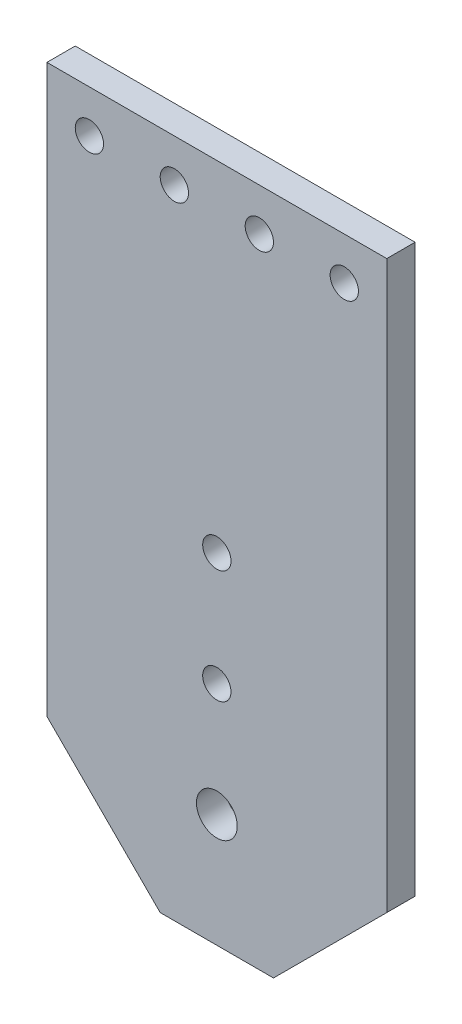
from build123d import *

# Parameters (mm, degrees)
SKETCH1_R           = 1.5875
SKETCH1_R_2         = 2.286
BOSS_EXTRUDE2_DEPTH = 3.175


with BuildPart() as part:
    # Sketch1 → Boss-Extrude2 (new body)
    with BuildSketch(Plane.XY):
        Polygon((-19.05, 4.7625), (-19.05, -58.7375), (-6.35, -71.4375), (6.35, -71.4375), (19.05, -58.7375), (19.05, 4.7625), align=None)
        with Locations((4.7625, 0)):
            Circle(SKETCH1_R, mode=Mode.SUBTRACT)
        with Locations((-4.7625, 0)):
            Circle(SKETCH1_R, mode=Mode.SUBTRACT)
        with Locations((0, -58.7375)):
            Circle(SKETCH1_R_2, mode=Mode.SUBTRACT)
        with Locations((14.2875, 0)):
            Circle(SKETCH1_R, mode=Mode.SUBTRACT)
        with Locations((-14.2875, 0)):
            Circle(SKETCH1_R, mode=Mode.SUBTRACT)
        with Locations((0, -46.0375)):
            Circle(SKETCH1_R, mode=Mode.SUBTRACT)
        with Locations((0, -33.3375)):
            Circle(SKETCH1_R, mode=Mode.SUBTRACT)
    extrude(amount=BOSS_EXTRUDE2_DEPTH)


solid = part.part
